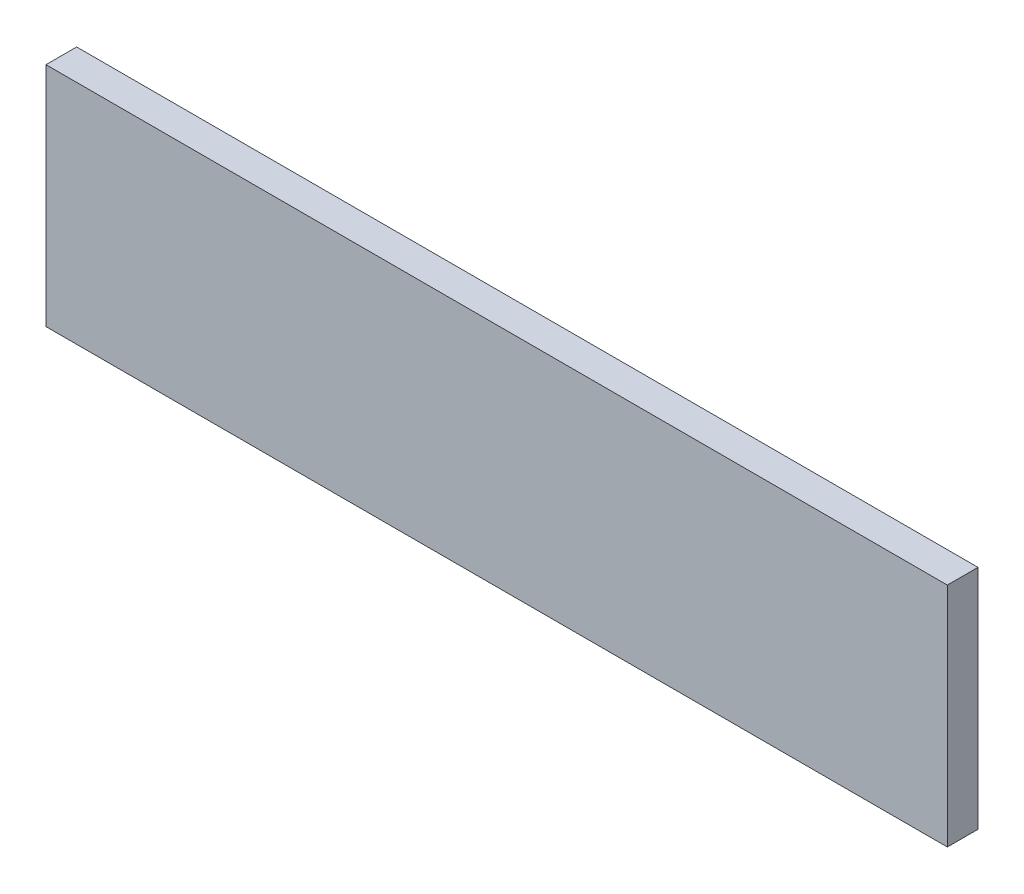
from build123d import *

# Parameters (mm, degrees)
SKETCH1_W           = 294
SKETCH1_H           = 74
BOSS_EXTRUDE1_DEPTH = 10


with BuildPart() as part:
    # Sketch1 → Boss-Extrude1 (new body)
    with BuildSketch(Plane.XY):
        with Locations((-180.300605602, 59.143326369)):
            Rectangle(SKETCH1_W, SKETCH1_H)
    extrude(amount=BOSS_EXTRUDE1_DEPTH)


solid = part.part
